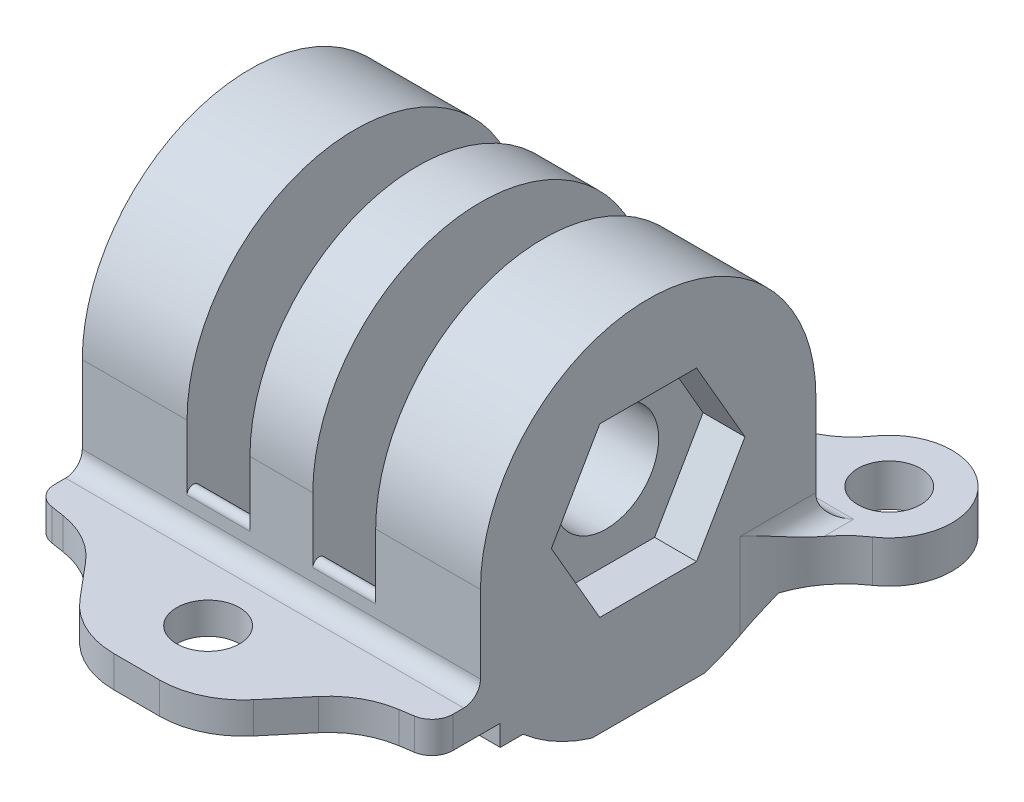
from build123d import *

# Parameters (mm, degrees)
EXTRUDE_1_DEPTH     = 6.5
SKETCH_1_7_R        = 1.5000000000000009
EXTRUDE_2_DEPTH     = 6
SKETCH_1_5_R        = 1.5000000000000009
CUT_EXTRUDE_1_DEPTH = 4
SKETCH_4_R          = 2.5000000000000018
EXTRUDE_3_DEPTH     = 9.5
SKETCH_4_3_R        = 8.002176317228214
CUT_EXTRUDE_3_DEPTH = 4.5
SKETCH_4_4_R        = 8.002176317228214
SKETCH_4_4_R_2      = 2.5000000000000018
EXTRUDE_4_DEPTH     = 1.5
CUT_EXTRUDE_7_DEPTH = 5
FILLET_10_R         = 5
FILLET_12_R         = 1
FILLET_8_R          = 4
FILLET_15_R         = 4
FILLET_14_R         = 0.8
FILLET_START        = 1.5
FILLET_16_DEPTH     = 3
CUT_EXTRUDE_8_DEPTH = 2


with BuildPart() as part:
    # 草图1 → 凸台-拉伸1 (new body)
    with BuildSketch(Plane(origin=(0, 0, 0), x_dir=(1, 0, 0), z_dir=(0, 1, 0))):
        with BuildLine():
            Line((6.526515759031646, -47.98540773429276), (9.500000000000004, -47.53500853797252))
            Line((9.5, -47.53500853797252), (9.5, -44.41312259021298))
            Line((9.5, -44.41312259021298), (-3.197e-14, -44.41312259021298))
            Line((-3.234e-14, -44.41312259021298), (-3.819e-14, -47.352813742384996))
            ThreePointArc((-3.795e-14, -47.352813742384996), (1.4999999999999172, -48.852813742385), (-6.167e-14, -50.35281374238498))
            Line((-6.167e-14, -50.35281374238498), (5e-17, -52.25281374238501))
            Line((5e-17, -52.25281374238501), (2.945736951557686, -52.25281374238501))
            Line((2.9457369515576866, -52.25281374238501), (6.52651575903164, -47.98540773429274))
        make_face()
    extrude(amount=EXTRUDE_1_DEPTH)

    # 草图1<7> → 凸台-拉伸2 (add)
    # profile 1 of 2: a face of its own
    with BuildSketch(Plane(origin=(0, 0, 0), x_dir=(1, 0, 0), z_dir=(0, 1, 0))):
        with BuildLine():
            Line((6.52651575903165, -47.98540773429276), (9.500000000000004, -47.53500853797252))
            Line((9.5, -47.53500853797252), (9.5, -44.41312259021298))
            Line((9.5, -44.41312259021298), (2.9999616443939274, -44.41312259021298))
            Line((2.9999616443939274, -44.41312259021298), (-3.197e-14, -44.41312259021298))
            Line((-3.234e-14, -44.41312259021298), (-3.532e-14, -45.852813742384946))
            ThreePointArc((-3.498e-14, -45.852813742384946), (2.001072491845667, -46.61770549391504), (2.981742421540369, -48.52234115413275))
            Line((2.981742421540467, -48.52234115413273), (6.52651575903165, -47.98540773429276))
        make_face()
    # profile 2 of 2: a face of its own
    with BuildSketch(Plane(origin=(0, 0, 0), x_dir=(1, 0, 0), z_dir=(0, 1, 0))):
        with BuildLine():
            Line((0, -29.352813742384996), (9.999999999999913, -29.352813742384996))
            ThreePointArc((9.999999999999913, -29.352813742384996), (12.121320343559674, -24.231493398825386), (7, -26.352813742384992))
            Line((6.999999999999999, -26.352813742384996), (-4.796e-14, -26.352813742384996))
            Line((0, -26.352813742384996), (0, -29.352813742384996))
        make_face()
        with Locations(Location((9.999999999999998, -26.352813742384996, 0), (0, 0, 270))):
            Circle(SKETCH_1_7_R, mode=Mode.SUBTRACT)
    extrude(amount=EXTRUDE_2_DEPTH)


with BuildPart() as extrude_2_piece_1:
    # of the separate pieces the step leaves, piece 1, a body of its own (extrude_2_pieces)
    add(part.part.solids().sort_by_distance((6.526515759, 0, 47.985407734))[0])


with BuildPart() as extrude_2_piece_2:
    # of the separate pieces the step leaves, piece 2, a body of its own (extrude_2_pieces)
    add(part.part.solids().sort_by_distance((0, 0, 26.352813742))[0])


with BuildPart() as cut_extrude_1_tool:
    # 草图1<5> → 切除-拉伸1 (new body)
    # profile 1 of 3: a face of its own
    with BuildSketch(Plane(origin=(0, 0, 0), x_dir=(1, 0, 0), z_dir=(0, 1, 0))):
        with BuildLine():
            ThreePointArc((1.232e-14, -51.85281374238499), (2.2351082484699845, -50.85388623423072), (2.9817424215404666, -48.52234115413273))
            ThreePointArc((2.981742421540369, -48.52234115413275), (2.001072491845667, -46.61770549391504), (-3.498e-14, -45.852813742384946))
            Line((-3.532e-14, -45.852813742384946), (-3.843e-14, -47.352813742384996))
            ThreePointArc((-3.795e-14, -47.352813742384996), (1.4999999999999172, -48.852813742385), (-6.167e-14, -50.35281374238498))
            Line((-6.167e-14, -50.35281374238498), (1.27e-14, -51.85281374238499))
        make_face()
    # profile 2 of 3: a face of its own
    with BuildSketch(Plane(origin=(0, 0, 0), x_dir=(1, 0, 0), z_dir=(0, 1, 0))):
        with BuildLine():
            Line((6.52651575903165, -47.98540773429276), (9.500000000000004, -47.53500853797252))
            Line((9.5, -47.53500853797252), (9.5, -44.41312259021298))
            Line((9.5, -44.41312259021298), (2.9999616443939274, -44.41312259021298))
            Line((2.9999616443939274, -44.41312259021298), (-3.197e-14, -44.41312259021298))
            Line((-3.234e-14, -44.41312259021298), (-3.532e-14, -45.852813742384946))
            ThreePointArc((-3.498e-14, -45.852813742384946), (2.001072491845667, -46.61770549391504), (2.981742421540369, -48.52234115413275))
            Line((2.981742421540467, -48.52234115413273), (6.52651575903165, -47.98540773429276))
        make_face()
    # profile 3 of 3: a face of its own
    with BuildSketch(Plane(origin=(0, 0, 0), x_dir=(1, 0, 0), z_dir=(0, 1, 0))):
        with BuildLine():
            Line((0, -29.352813742384996), (9.999999999999913, -29.352813742384996))
            ThreePointArc((9.999999999999913, -29.352813742384996), (12.121320343559674, -24.231493398825386), (7, -26.352813742384992))
            Line((6.999999999999999, -26.352813742384996), (-4.796e-14, -26.352813742384996))
            Line((0, -26.352813742384996), (0, -29.352813742384996))
        make_face()
        with Locations(Location((9.999999999999998, -26.352813742384996, 0), (0, 0, 270))):
            Circle(SKETCH_1_5_R, mode=Mode.SUBTRACT)
    extrude(amount=CUT_EXTRUDE_1_DEPTH)


with BuildPart() as extrude_2_piece_1_1:
    add(extrude_2_piece_1.part)

    # 切除-拉伸1: cut by cut_extrude_1_tool
    add(cut_extrude_1_tool.part, mode=Mode.SUBTRACT)



with BuildPart() as extrude_2_piece_2_1:
    add(extrude_2_piece_2.part)

    # 切除-拉伸1: cut by cut_extrude_1_tool
    add(cut_extrude_1_tool.part, mode=Mode.SUBTRACT)


with BuildPart() as extrude_2_piece_1_2:
    add(extrude_2_piece_1_1.part)

    add(extrude_2_piece_2_1.part)  # 凸台-拉伸3 merges 凸台-拉伸2 piece 2
    # 草图4 → 凸台-拉伸3 (add)
    with BuildSketch(Plane.ZY):
        with BuildLine():
            Line((43.32806789988807, 4), (44.41312259021298, 4))
            Line((44.41312259021298, 4), (44.41312259021298, 6.5))
            Line((44.41312259021298, 6.5), (45.35716637684143, 6.5))
            Line((45.35716637684143, 6.5), (45.35716637684143, 10.99730956254026))
            ThreePointArc((45.35716637684142, 10.99730956254026), (37.35499005961321, 18.99948587976847), (29.352813742384996, 10.997309562540261))
            Line((29.352813742384996, 10.99730956254026), (29.352813742384996, 4))
            Line((29.352813742384996, 4), (31.381912219338343, 4))
            ThreePointArc((31.381912219338343, 3.9999999999999982), (32.93395366796542, 2.929197191996211), (34.67170848661348, 2.1973095625402532))
            Line((34.67170848661348, 2.1973095625402554), (40.03827163261293, 2.1973095625402554))
            ThreePointArc((40.03827163261293, 2.1973095625402532), (41.776026451261, 2.929197191996213), (43.32806789988807, 4))
        make_face()
        with Locations((37.35499005961321, 10.99730956254026)):
            Circle(SKETCH_4_R, mode=Mode.SUBTRACT)
    extrude(amount=-EXTRUDE_3_DEPTH)

    # 草图4<3> → 切除-拉伸3 (cut)
    with BuildSketch(Plane.ZY):
        with Locations((37.35499005961321, 10.99730956254026)):
            Circle(SKETCH_4_3_R)
    extrude(amount=-CUT_EXTRUDE_3_DEPTH, mode=Mode.SUBTRACT)

    # 草图4<4> → 凸台-拉伸4 (add)
    with BuildSketch(Plane.ZY):
        with Locations((37.35499005961321, 10.99730956254026)):
            Circle(SKETCH_4_4_R)
        with Locations((37.35499005961321, 10.99730956254026)):
            Circle(SKETCH_4_4_R_2, mode=Mode.SUBTRACT)
    extrude(amount=-EXTRUDE_4_DEPTH)

    # 草图1<8> → 切除-拉伸7 (cut)
    with BuildSketch(Plane(origin=(0, 0, 0), x_dir=(1, 0, 0), z_dir=(0, 1, 0))):
        with BuildLine():
            Line((6.52651575903165, -47.98540773429276), (9.500000000000004, -47.53500853797252))
            Line((9.5, -47.53500853797252), (9.5, -44.41312259021298))
            Line((9.5, -44.41312259021298), (2.9999616443939274, -44.41312259021298))
            Line((2.9999616443939274, -44.41312259021298), (-3.197e-14, -44.41312259021298))
            Line((-3.234e-14, -44.41312259021298), (-3.532e-14, -45.852813742384946))
            ThreePointArc((-3.365e-14, -45.852813742384946), (2.001072491845667, -46.61770549391504), (2.9817424215403685, -48.52234115413274))
            Line((2.981742421540467, -48.52234115413273), (6.52651575903165, -47.98540773429276))
        make_face()
        with BuildLine():
            ThreePointArc((1.232e-14, -51.85281374238499), (2.2351082484699845, -50.85388623423072), (2.9817424215404666, -48.52234115413273))
            ThreePointArc((2.981742421540369, -48.52234115413275), (2.001072491845667, -46.61770549391504), (-3.498e-14, -45.852813742384946))
            Line((-3.532e-14, -45.852813742384946), (-3.843e-14, -47.352813742384996))
            ThreePointArc((-3.795e-14, -47.352813742384996), (1.4999999999999172, -48.852813742385), (-6.167e-14, -50.35281374238498))
            Line((-6.167e-14, -50.35281374238498), (1.27e-14, -51.85281374238499))
        make_face()
        with BuildLine():
            Line((2.9457369515576866, -52.25281374238501), (6.52651575903164, -47.98540773429274))
            Line((6.52651575903165, -47.98540773429276), (2.981742421540467, -48.52234115413273))
            ThreePointArc((2.9817424215404666, -48.52234115413273), (2.2351082484699845, -50.85388623423072), (1.232e-14, -51.85281374238499))
            Line((1.27e-14, -51.85281374238499), (5e-17, -52.25281374238501))
            Line((5e-17, -52.25281374238501), (2.945736951557686, -52.25281374238501))
        make_face()
    extrude(amount=CUT_EXTRUDE_7_DEPTH, mode=Mode.SUBTRACT)

    # 圆角10
    # the kernel refuses this fillet: 5 mm, written as the material it adds along each edge
    with BuildSketch(Plane(origin=(9.5, 6, 29.352813742384996), x_dir=(0, 0, 1), z_dir=(0, -1, 0))) as fillet_10_piece_1:
        with BuildLine():
            CenterArc((3.614378277661473, -5), FILLET_10_R, 90, 55.77113367218743)
            Line((-0.5196081458769513, -2.1875), (-0.9330067882307951, -1.90625))
            ThreePointArc((-0.9330067882307951, -1.90625), (-0.5, -0.49999999999992717), (-0.5, 0))
            Line((-0.5, 0), (0, 0.5))
            Line((0, 0.5), (3.614378277661473, 0.5))
            Line((3.614378277661473, 0.5), (3.614378277661473, 0))
        make_face()
    extrude(amount=2)
    with BuildSketch(Plane(origin=(9.5, 6, 29.352813742384996), x_dir=(0, 0, 1), z_dir=(0, -1, 0))) as fillet_10_piece_2_section:
        with BuildLine():
            CenterArc((3.614378277661473, -5), FILLET_10_R, 90, 55.77113367218743)
            Line((-0.5196081458769513, -2.1875), (-0.9330067882307951, -1.90625))
            ThreePointArc((-0.9330067882307951, -1.90625), (-0.5, -0.49999999999992717), (-0.5, 0))
            Line((-0.5, 0), (0, 0.5))
            Line((0, 0.5), (3.614378277661473, 0.5))
            Line((3.614378277661473, 0.5), (3.614378277661473, 0))
        make_face()
    fillet_10_piece_2 = extrude(amount=11.035945694153682, mode=Mode.PRIVATE)
    fillet_10_piece_2 = fillet_10_piece_2 & Plane(origin=(9.5, 10.997309562540337, 37.35499005961324), x_dir=(0, -0.7605771263630735, -0.6492475913342225), z_dir=(-1, 0, 0)) * Cylinder(9.200000000000085, 37, mode=Mode.PRIVATE)
    add(fillet_10_piece_2)

    # 圆角12
    fillet_12_edges = [extrude_2_piece_1_2.edges().sort_by_distance(p)[0] for p in [
        (9.5, 6, 31.160002881215497),
        (9.500000000000002, 5.75, 47.53500853797252),
    ]]
    fillet(fillet_12_edges, radius=FILLET_12_R)

    # 圆角8
    fillet_8_edges = [extrude_2_piece_1_2.edges().sort_by_distance(p)[0] for p in [
        (2.945736951557686, 5.75, 52.25281374238501),
        (6.526515759031643, 5.75, 47.98540773429275),
    ]]
    fillet(fillet_8_edges, radius=FILLET_8_R)

    # 圆角15
    fillet_15_edges = [extrude_2_piece_1_2.edges().sort_by_distance(p)[0] for p in [
        (7, 5, 26.352813742384996),
    ]]
    fillet(fillet_15_edges, radius=FILLET_15_R)

    # 圆角14
    fillet_14_edges = [extrude_2_piece_1_2.edges().sort_by_distance(p)[0] for p in [
        (5.25, 6, 29.352813742384996),
        (4.75, 6.5, 45.35716637684143),
    ]]
    fillet(fillet_14_edges, radius=FILLET_14_R)

    # 圆角16: read off the stored shape, not the designer's step
    # 圆角16 outline → 圆角16 (cut)
    with BuildSketch(Plane.YZ.offset(FILLET_START)):
        with BuildLine():
            ThreePointArc((10.997309563, 29.352813742), (9.476157021, 29.498723722), (8.010477223, 29.93113268))
            ThreePointArc((8.010477223, 29.93113268), (8.193031336, 29.595786035), (7.898501472, 29.352813742))
            Line((7.898501472, 29.352813742), (10.997309563, 29.352813742))
        make_face()
        with BuildLine():
            ThreePointArc((7.898501472, 45.357166377), (8.193031336, 45.114194084), (8.010477223, 44.778847439))
            ThreePointArc((8.010477223, 44.778847439), (9.476157021, 45.211256397), (10.997309563, 45.357166377))
            Line((10.997309563, 45.357166377), (7.898501472, 45.357166377))
        make_face()
    extrude(amount=FILLET_16_DEPTH, mode=Mode.SUBTRACT)

    # 镜向1: 凸台-拉伸2 piece 1 across plane


with BuildPart() as extrude_2_piece_1_3:
    add(extrude_2_piece_1_2.part)
    add(extrude_2_piece_1_2.part.mirror(Plane(origin=(0, 6, 0), x_dir=(0, 0, 1), z_dir=(-1, 0, 0))))

    # 草图5 → 切除-拉伸8 (cut)
    with BuildSketch(Plane(origin=(9.5, 0, 0), x_dir=(0, 0, -1), z_dir=(1, 0, 0))):
        Polygon((-41.97379221313022, 10.997309562540254), (-39.66439113637171, 6.9973095625402575), (-35.0455889828547, 6.997309562540257), (-32.7361879060962, 10.997309562540261), (-35.0455889828547, 14.997309562540265), (-39.664391136371705, 14.997309562540265), align=None)
    extrude(amount=-CUT_EXTRUDE_8_DEPTH, mode=Mode.SUBTRACT)


solid = extrude_2_piece_1_3.part
